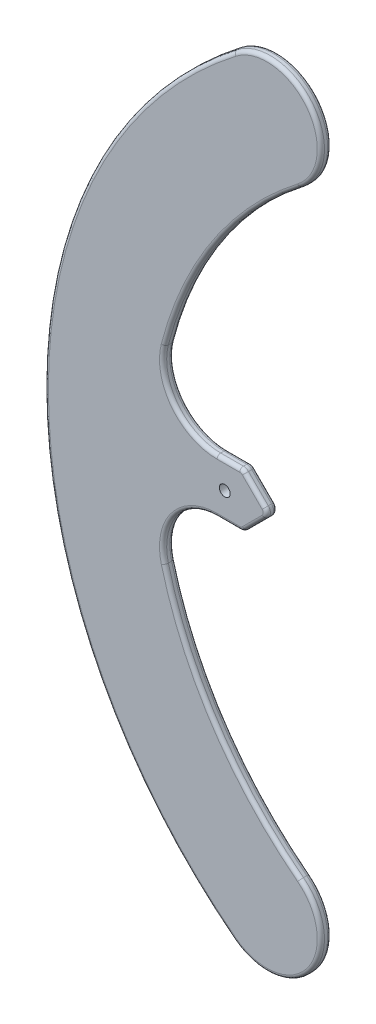
from build123d import *

# Parameters (mm, degrees)
SKETCH1_R           = 1.5
BOSS_EXTRUDE1_DEPTH = 2.9
FILLET1_R           = 15
FILLET2_R           = 2
FILLET3_R           = 1


with BuildPart() as part:
    # Sketch1 → Boss-Extrude1 (new body)
    with BuildSketch(Plane.XY):
        with BuildLine():
            ThreePointArc((-11.978690202, -106.875000176), (9.060608576, -104.164298847), (6.349907492, -83.125000037))
            ThreePointArc((6.349907492, -83.125000037), (-22.020584681, -49.648176304), (-34.231800328, -7.5))
            Line((-34.231800328, -7.5), (-9.5, -7.5))
            Line((-9.5, -7.5), (-2, 0))
            Line((-2, 0), (-9.5, 7.5))
            Line((-9.5, 7.5), (-34.231800328, 7.5))
            ThreePointArc((-34.231800328, 7.5), (-22.020584787, 49.648176107), (6.349907137, 83.124999763))
            ThreePointArc((6.349907137, 83.124999763), (9.060608638, 104.164298767), (-11.978690398, 106.875000025))
            ThreePointArc((-11.978690398, 106.875000025), (-64.5, -1.24e-07), (-11.978690202, -106.875000176))
        make_face()
        with Locations((-14.5, 0)):
            Circle(SKETCH1_R, mode=Mode.SUBTRACT)
    extrude(amount=BOSS_EXTRUDE1_DEPTH)

    # Fillet1
    fillet1_edges = [part.edges().sort_by_distance(p)[0] for p in [
        (-34.231800328, -7.5, 1.45),
        (-34.231800328, 7.5, 1.45),
    ]]
    fillet(fillet1_edges, radius=FILLET1_R)

    # Fillet2
    fillet2_edges = [part.edges().sort_by_distance(p)[0] for p in [
        (-9.5, -7.5, 1.45),
        (-9.5, 7.5, 1.45),
        (-2, 0, 1.45),
    ]]
    fillet(fillet2_edges, radius=FILLET2_R)

    # Fillet3
    fillet3_edges = [part.edges().sort_by_distance(p)[0] for p in [
        (-13.485276207, 7.5, 2.9),
        (-9.56306026, 7.347759065, 2.9),
        (-6.164213562, 4.164213562, 2.9),
        (-2.828427125, 0, 2.9),
        (-6.164213562, -4.164213562, 2.9),
        (-9.56306026, -7.347759065, 2.9),
        (-13.485276207, -7.5, 2.9),
        (-28.500666515, -13.314413465, 2.9),
        (-17.149415422, -57.815049738, 2.9),
        (9.060608576, -104.164298847, 2.9),
        (-64.5, -1.24e-07, 2.9),
        (9.060608638, 104.164298767, 2.9),
        (-17.149415545, 57.815049551, 2.9),
        (-17.149415545, 57.815049551, 0),
        (9.060608638, 104.164298767, 0),
        (-64.5, -1.24e-07, 0),
        (9.060608576, -104.164298847, 0),
        (-17.149415422, -57.815049738, 0),
        (-28.500666515, -13.314413465, 0),
        (-13.485276207, -7.5, 0),
        (-9.56306026, -7.347759065, 0),
        (-6.164213562, -4.164213562, 0),
        (-2.828427125, 0, 0),
        (-6.164213562, 4.164213562, 0),
        (-9.56306026, 7.347759065, 0),
        (-13.485276207, 7.5, 0),
        (-28.500666515, 13.314413465, 2.9),
        (-28.500666515, 13.314413465, 0),
    ]]
    fillet(fillet3_edges, radius=FILLET3_R)


solid = part.part
